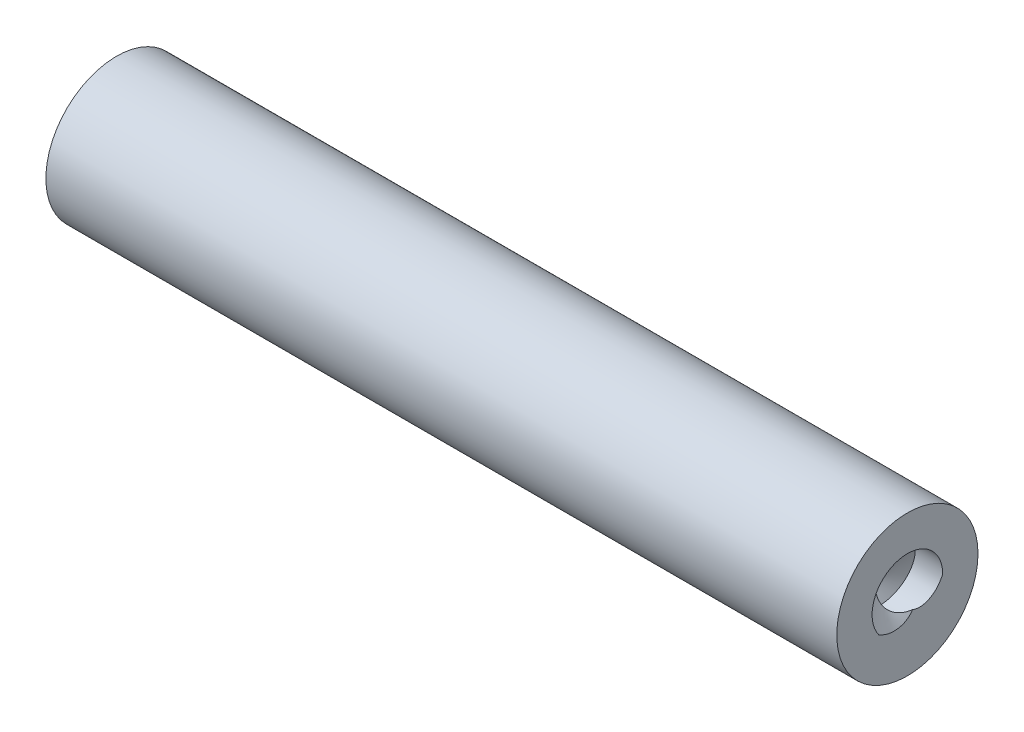
from build123d import *

# Parameters (mm, degrees)
BOSS_EXTRUDE1_DEPTH      = 42
BOSS_EXTRUDE1_DEPTH_BACK = 42
SKETCH1_R                = 7.5
SKETCH1_R_2              = 3.75
SWEEP1_PITCH             = 5
CUT_EXTRUDE1_DEPTH       = 42
CUT_EXTRUDE1_DEPTH_BACK  = 42
SKETCH4_W                = 14.285385809
SKETCH4_H                = 15
SKETCH4_W_2              = 18.474634769
BOSS_EXTRUDE2_DEPTH      = 22
BOSS_EXTRUDE2_DEPTH_BACK = 22
SKETCH5_R                = 3.75


with BuildPart() as part:
    # Sketch1 → Boss-Extrude1 (new, two sides: drawn at the far end of the back side and taken through both)
    with BuildSketch(Plane(origin=(0, 0, 0), x_dir=(0, 0, -1), z_dir=(1, 0, 0)).offset(-BOSS_EXTRUDE1_DEPTH_BACK)):
        Circle(SKETCH1_R)
        Circle(SKETCH1_R_2, mode=Mode.SUBTRACT)
    extrude(amount=BOSS_EXTRUDE1_DEPTH + BOSS_EXTRUDE1_DEPTH_BACK)

    # Sweep1: arcs per turn and ends read off the stored shape
    # Sweep1: the profile of Sketch3 screwed along a right-hand helix through 17.5 turns, 12 arcs to a turn; built about Z, then put on its axis
    sweep1_z = Axis((0, 0, 0), (0, 0, 1))
    sweep1_corners = [(-3.75, 0, -42.625), (-3.75, 0, -43.625), (-1.75, 0, -42.625), (-3.75, 0, -41.625)]
    with BuildLine(mode=Mode.PRIVATE) as sweep1_profile:
        Line(sweep1_corners[0], sweep1_corners[1])
        Line(sweep1_corners[1], sweep1_corners[2])
        Line(sweep1_corners[2], sweep1_corners[3])
        Line(sweep1_corners[3], sweep1_corners[0])
    sweep1_cap = Face(sweep1_profile.wire())
    sweep1_turn_angles = [0, 15, 30, 45, 60, 75, 90, 105, 120, 135, 150, 165, 180, 195, 210, 225, 240, 255, 270, 285, 300, 315, 330, 345, 360]
    sweep1_turn_weights = [1, 0.9659258262890683, 1, 0.9659258262890683, 1, 0.9659258262890683, 1, 0.9659258262890683, 1, 0.9659258262890683, 1, 0.9659258262890683, 1, 0.9659258262890683, 1, 0.9659258262890683, 1, 0.9659258262890683, 1, 0.9659258262890683, 1, 0.9659258262890683, 1, 0.9659258262890683, 1]
    sweep1_turn_rails = [Edge.make_bspline([Vector(p[0], p[1], 0).rotate(sweep1_z, sweep1_turn_angles[k]) / sweep1_turn_weights[k] + Vector(0, 0, p[2] + SWEEP1_PITCH * sweep1_turn_angles[k] / 360) for k in range(25)], [0, 0, 0, 1, 1, 2, 2, 3, 3, 4, 4, 5, 5, 6, 6, 7, 7, 8, 8, 9, 9, 10, 10, 11, 11, 12, 12, 12], 2, sweep1_turn_weights) for p in sweep1_corners]
    sweep1_turn_sides = [Face.make_surface_from_curves(sweep1_turn_rails[p[0]], sweep1_turn_rails[p[1]]) for p in [(0, 1), (1, 2), (2, 3), (3, 0)]]
    sweep1_last_angles = [6120, 6135, 6150, 6165, 6180, 6195, 6210, 6225, 6240, 6255, 6270, 6285, 6300]
    sweep1_last_weights = [1, 0.9659258262890683, 1, 0.9659258262890683, 1, 0.9659258262890683, 1, 0.9659258262890683, 1, 0.9659258262890683, 1, 0.9659258262889204, 1]
    sweep1_last_rails = [Edge.make_bspline([Vector(p[0], p[1], 0).rotate(sweep1_z, sweep1_last_angles[k]) / sweep1_last_weights[k] + Vector(0, 0, p[2] + SWEEP1_PITCH * sweep1_last_angles[k] / 360) for k in range(13)], [0, 0, 0, 1, 1, 2, 2, 3, 3, 4, 4, 5, 5, 6, 6, 6], 2, sweep1_last_weights) for p in sweep1_corners]
    sweep1_last_sides = [Face.make_surface_from_curves(sweep1_last_rails[p[0]], sweep1_last_rails[p[1]]) for p in [(0, 1), (1, 2), (2, 3), (3, 0)]]
    sweep1 = Plane(origin=(0, 0, 0), x_dir=(0, 0.7071067811865438, 0.7071067811865512), z_dir=(1, 0, 0)) * Solid(Shell([*[p.moved(Location((0, 0, SWEEP1_PITCH * i))) for i in range(17) for p in sweep1_turn_sides], *sweep1_last_sides, sweep1_cap, sweep1_cap.rotate(sweep1_z, 6300).moved(Location((0, 0, SWEEP1_PITCH * 6300 / 360)))]))
    add(sweep1)

    # Sketch4 → Cut-Extrude1 (cut, two sides: drawn at the far end of the back side and taken through both)
    with BuildSketch(Plane(origin=(0, 0, 0), x_dir=(1, 0, 0), z_dir=(0, 1, 0)).offset(-CUT_EXTRUDE1_DEPTH_BACK)):
        with Locations((-49.142692905, 0)):
            Rectangle(SKETCH4_W, SKETCH4_H)
        with Locations((51.237317385, 0)):
            Rectangle(SKETCH4_W_2, SKETCH4_H)
    extrude(amount=CUT_EXTRUDE1_DEPTH + CUT_EXTRUDE1_DEPTH_BACK, mode=Mode.SUBTRACT)

    # Sketch5 → Boss-Extrude2 (add, two sides: drawn at the far end of the back side and taken through both)
    with BuildSketch(Plane(origin=(0, 0, 0), x_dir=(0, 0, -1), z_dir=(1, 0, 0)).offset(-BOSS_EXTRUDE2_DEPTH_BACK)):
        Circle(SKETCH5_R)
    extrude(amount=BOSS_EXTRUDE2_DEPTH + BOSS_EXTRUDE2_DEPTH_BACK)


solid = part.part
